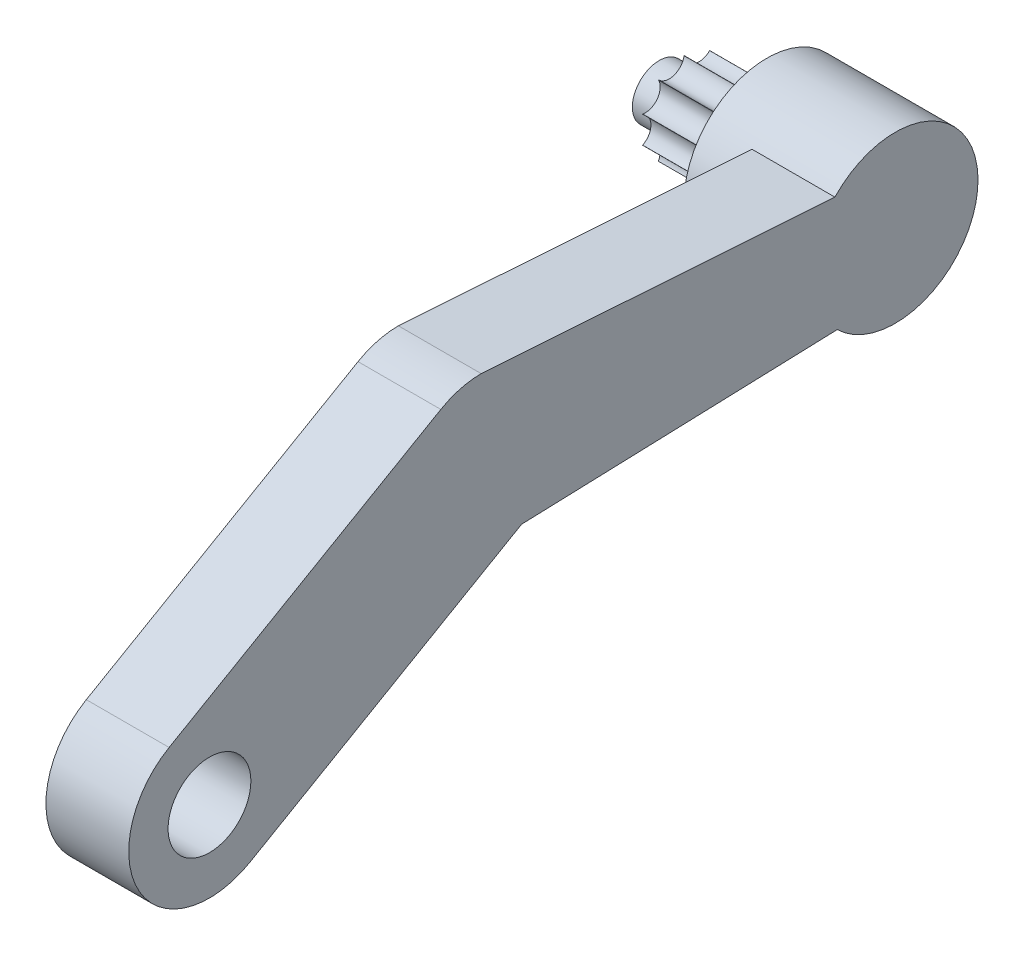
from build123d import *

# Parameters (mm, degrees)
EXTRUDE_2_DEPTH      = 10
EXTRUDE_2_DEPTH_BACK = 10
SKETCH_1_R           = 10
EXTRUDE_START        = 11
SKETCH_4_R           = 20
EXTRUDE_4_DEPTH      = 11
SKETCH_5_R           = 10.5
EXTRUDE_5_DEPTH      = 26
CUT_EXTRUDE_START    = -6
SKETCH_6_R           = 10.5
SKETCH_6_R_2         = 6.5
CUT_EXTRUDE_1_DEPTH  = 6
CUT_EXTRUDE_START_2  = -18
CUT_EXTRUDE_2_DEPTH  = 18


with BuildPart() as part:
    # ｽｹｯﾁ1 → ﾎﾞｽ - 押し出し2 (new, two sides: drawn at the far end of the back side and taken through both)
    with BuildSketch(Plane(origin=(0, 0, 0), x_dir=(0, 0, -1), z_dir=(1, 0, 0)).offset(-EXTRUDE_2_DEPTH_BACK)):
        with BuildLine():
            Line((-155.878543104, -54.778152402), (-90.25, -16.887495374))
            Line((-90.25, -16.887495374), (-13.99498136, -14.28777438))
            ThreePointArc((-13.99498136, -14.28777438), (19.99585784, 0.407024862), (-14.564816166, 13.706426596))
            Line((-14.564816166, 13.706426596), (-100, 19.5))
            ThreePointArc((-100, 19.5), (-105.046971379, 18.835553613), (-109.75, 16.887495374))
            Line((-109.75, 16.887495374), (-175.378543104, -21.003161654))
            ThreePointArc((-175.378543104, -21.003161654), (-182.516038478, -47.640657028), (-155.878543104, -54.778152402))
        make_face()
        with Locations((-165.628543104, -37.890657028)):
            Circle(SKETCH_1_R, mode=Mode.SUBTRACT)
    extrude(amount=EXTRUDE_2_DEPTH + EXTRUDE_2_DEPTH_BACK)

    # ｽｹｯﾁ4 → ﾎﾞｽ - 押し出し4 (add)
    with BuildSketch(Plane.ZY.offset(10).offset(EXTRUDE_START)):
        Circle(SKETCH_4_R)
    extrude(amount=-EXTRUDE_4_DEPTH)

    # ｽｹｯﾁ5 → ﾎﾞｽ - 押し出し5 (add)
    with BuildSketch(Plane.ZY.offset(21)):
        Circle(SKETCH_5_R)
    extrude(amount=EXTRUDE_5_DEPTH)

    # ｽｹｯﾁ6 → ｶｯﾄ - 押し出し1 (cut)
    with BuildSketch(Plane.ZY.offset(47).offset(CUT_EXTRUDE_START)):
        Circle(SKETCH_6_R)
        Circle(SKETCH_6_R_2, mode=Mode.SUBTRACT)
    extrude(amount=CUT_EXTRUDE_1_DEPTH, mode=Mode.SUBTRACT)

    # ｽｹｯﾁ7 → ｶｯﾄ - 押し出し2 (cut)
    with BuildSketch(Plane.ZY.offset(41).offset(CUT_EXTRUDE_START_2)):
        with BuildLine():
            ThreePointArc((6.13822906, 8.518928571), (3.225, 9.992465912), (0, 10.5))
            ThreePointArc((0, 10.5), (2.457142857, 7.613307361), (6.13822906, 8.518928571))
        make_face()
        with BuildLine():
            ThreePointArc((-6.171745149, 8.494678441), (-2.487119459, 7.603567373), (-0.041368955, 10.499918505))
            ThreePointArc((-0.041368955, 10.499918505), (-3.26434429, 9.979682177), (-6.171745149, 8.494678441))
        make_face()
        with BuildLine():
            ThreePointArc((9.973232205, 3.283997471), (8.482503904, 6.1884673), (6.171745149, 8.494678441))
            ThreePointArc((6.171745149, 8.494678441), (6.462860117, 4.715022705), (9.973232205, 3.283997471))
        make_face()
        with BuildLine():
            ThreePointArc((-9.986093421, 3.244678441), (-6.481386676, 4.689523084), (-6.205165435, 8.470296449))
            ThreePointArc((-6.205165435, 8.470296449), (-8.506820012, 6.154999048), (-9.986093421, 3.244678441))
        make_face()
        with BuildLine():
            ThreePointArc((9.998799625, -3.205309044), (10.499979626, 0.020684517), (9.986093421, 3.244678441))
            ThreePointArc((9.986093421, 3.244678441), (7.999984477, 0.015759632), (9.998799625, -3.205309044))
        make_face()
        with BuildLine():
            ThreePointArc((-9.986093421, -3.244678441), (-7.999984477, -0.015759632), (-9.998799625, 3.205309044))
            ThreePointArc((-9.998799625, 3.205309044), (-10.499979626, -0.020684517), (-9.986093421, -3.244678441))
        make_face()
        with BuildLine():
            ThreePointArc((6.205165435, -8.470296449), (8.506820012, -6.154999048), (9.986093421, -3.244678441))
            ThreePointArc((9.986093421, -3.244678441), (6.481386676, -4.689523084), (6.205165435, -8.470296449))
        make_face()
        with BuildLine():
            ThreePointArc((-6.171745149, -8.494678441), (-6.462860117, -4.715022705), (-9.973232205, -3.283997471))
            ThreePointArc((-9.973232205, -3.283997471), (-8.482503904, -6.1884673), (-6.171745149, -8.494678441))
        make_face()
        with BuildLine():
            ThreePointArc((0.041368955, -10.499918505), (3.26434429, -9.979682177), (6.171745149, -8.494678441))
            ThreePointArc((6.171745149, -8.494678441), (2.487119459, -7.603567373), (0.041368955, -10.499918505))
        make_face()
        with BuildLine():
            ThreePointArc((0, -10.5), (-2.457142857, -7.613307361), (-6.13822906, -8.518928571))
            ThreePointArc((-6.13822906, -8.518928571), (-3.225, -9.992465912), (0, -10.5))
        make_face()
    extrude(amount=CUT_EXTRUDE_2_DEPTH, mode=Mode.SUBTRACT)


solid = part.part
